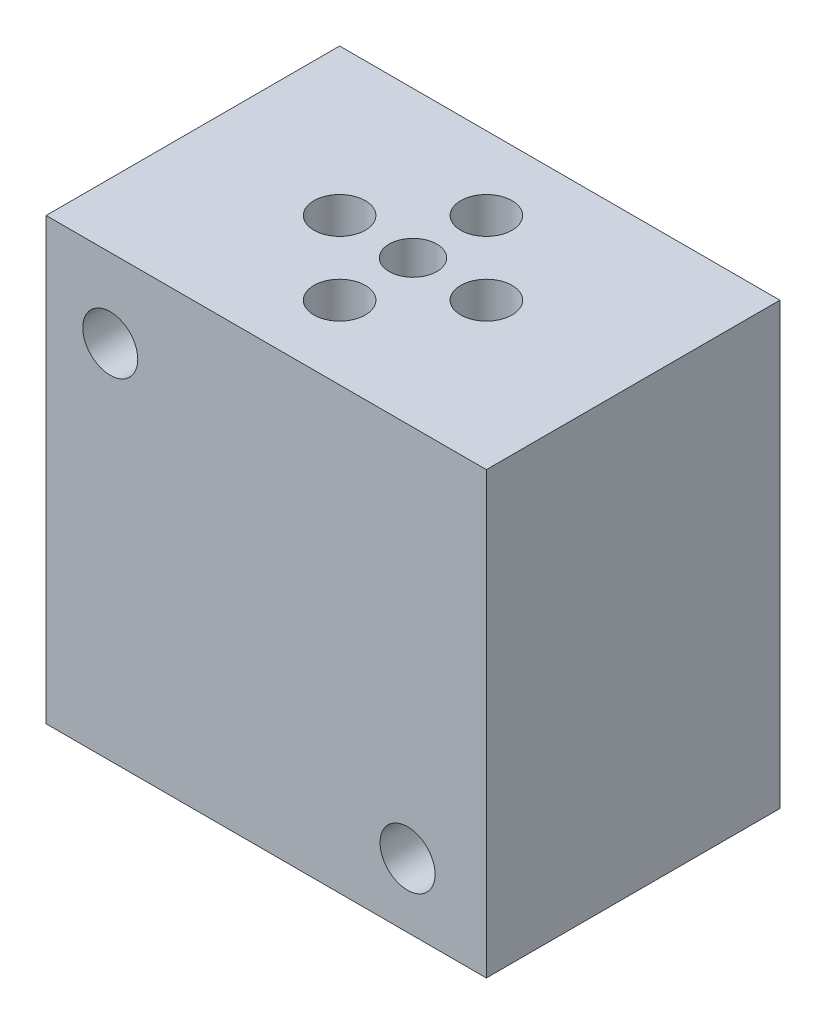
from build123d import *

# Parameters (mm, degrees)
SKETCH3_W           = 76.2
SKETCH3_H           = 50.8
BOSS_EXTRUDE1_DEPTH = 76.2
SKETCH5_R           = 4.1275
CUT_EXTRUDE1_DEPTH  = 76.2
SKETCH6_R           = 4.445
CUT_EXTRUDE2_DEPTH  = 76.2
SKETCH8_R           = 4.445
CUT_EXTRUDE4_DEPTH  = 76.2
SKETCH9_R           = 4.445
CUT_EXTRUDE5_DEPTH  = 76.2
SKETCH10_R          = 4.445
CUT_EXTRUDE6_DEPTH  = 76.2
SKETCH12_R          = 4.7625
CUT_EXTRUDE7_DEPTH  = 76.2
SKETCH13_R          = 4.7625
CUT_EXTRUDE8_DEPTH  = 76.2


with BuildPart() as part:
    # Sketch3 → Boss-Extrude1 (new body)
    with BuildSketch(Plane(origin=(0, 0, 0), x_dir=(1, 0, 0), z_dir=(0, 1, 0))):
        with Locations((-2.241176471, -1.805392157)):
            Rectangle(SKETCH3_W, SKETCH3_H)
    extrude(amount=BOSS_EXTRUDE1_DEPTH)

    # Sketch5 → Cut-Extrude1 (cut)
    with BuildSketch(Plane(origin=(0, 76.2, 0), x_dir=(1, 0, 0), z_dir=(0, 1, 0))):
        with Locations((-2.241176471, -1.805392157)):
            Circle(SKETCH5_R)
    extrude(amount=-CUT_EXTRUDE1_DEPTH, mode=Mode.SUBTRACT)

    # Sketch6 → Cut-Extrude2 (cut)
    with BuildSketch(Plane(origin=(0, 76.2, 0), x_dir=(1, 0, 0), z_dir=(0, 1, 0))):
        with Locations((-14.941176471, -1.805392157)):
            Circle(SKETCH6_R)
    extrude(amount=-CUT_EXTRUDE2_DEPTH, mode=Mode.SUBTRACT)

    # Sketch8 → Cut-Extrude4 (cut)
    with BuildSketch(Plane(origin=(0, 76.2, 0), x_dir=(1, 0, 0), z_dir=(0, 1, 0))):
        with Locations((10.458823529, -1.805392157)):
            Circle(SKETCH8_R)
    extrude(amount=-CUT_EXTRUDE4_DEPTH, mode=Mode.SUBTRACT)

    # Sketch9 → Cut-Extrude5 (cut)
    with BuildSketch(Plane(origin=(0, 76.2, 0), x_dir=(1, 0, 0), z_dir=(0, 1, 0))):
        with Locations((-2.241176471, -14.505392157)):
            Circle(SKETCH9_R)
    extrude(amount=-CUT_EXTRUDE5_DEPTH, mode=Mode.SUBTRACT)

    # Sketch10 → Cut-Extrude6 (cut)
    with BuildSketch(Plane(origin=(0, 76.2, 0), x_dir=(1, 0, 0), z_dir=(0, 1, 0))):
        with Locations((-2.241176471, 10.894607843)):
            Circle(SKETCH10_R)
    extrude(amount=-CUT_EXTRUDE6_DEPTH, mode=Mode.SUBTRACT)

    # Sketch12 → Cut-Extrude7 (cut)
    with BuildSketch(Plane.XY.offset(27.205392157)):
        with Locations((-29.241376471, 62.5602)):
            Circle(SKETCH12_R)
    extrude(amount=-CUT_EXTRUDE7_DEPTH, mode=Mode.SUBTRACT)

    # Sketch13 → Cut-Extrude8 (cut)
    with BuildSketch(Plane.XY.offset(27.205392157)):
        with Locations((22.219023529, 11.0998)):
            Circle(SKETCH13_R)
        with Locations((-29.241376471, 62.5602)):
            Circle(SKETCH13_R)
    extrude(amount=-CUT_EXTRUDE8_DEPTH, mode=Mode.SUBTRACT)


solid = part.part
